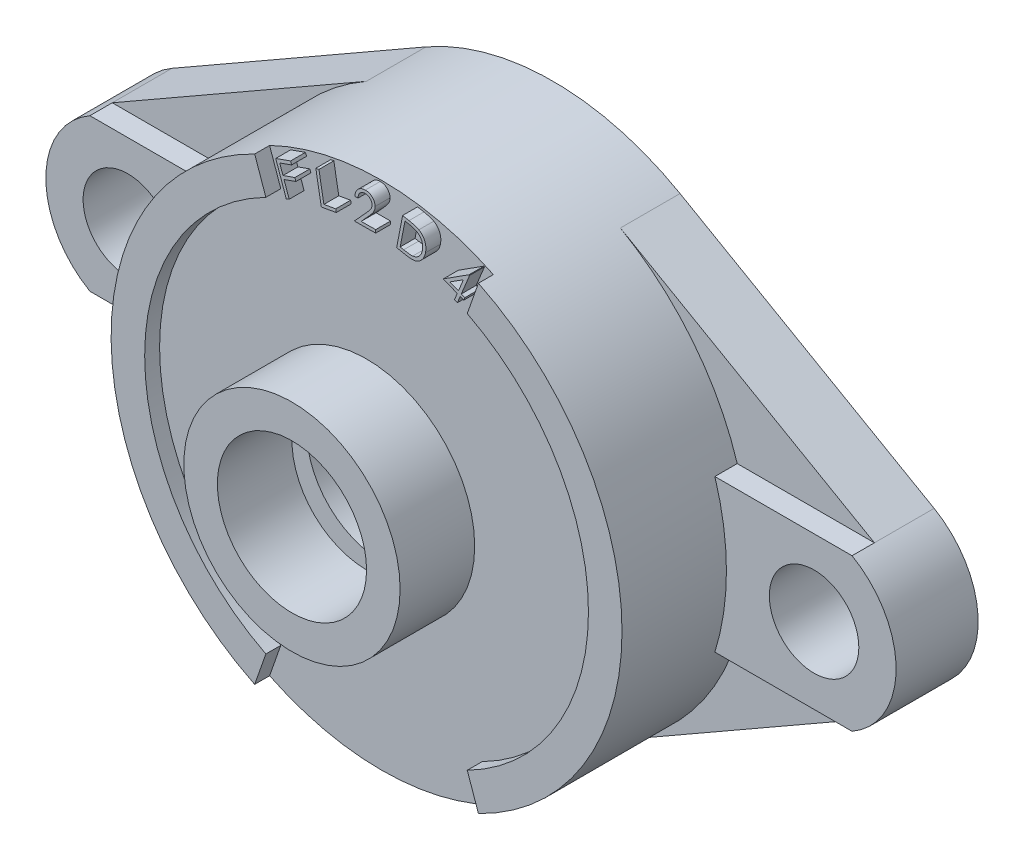
from build123d import *

# Parameters (mm, degrees)
RESSALTO_EXTRUS_O1_DEPTH = 8
ESBO_O2_R                = 34.25
RESSALTO_EXTRUS_O2_DEPTH = 17
RESSALTO_EXTRUS_O3_DEPTH = 3
ESBO_O4_R                = 6
CORTE_EXTRUS_O1_DEPTH    = 72.042680833
ESBO_O5_R                = 14.5
RESSALTO_EXTRUS_O4_DEPTH = 10
ESBO_O6_R                = 10
CORTE_EXTRUS_O2_DEPTH    = 76.146939392
ESBO_O7_OUTSIDE_W        = 143.506
ESBO_O7_OUTSIDE_H        = 98.006
CORTE_EXTRUS_O3_DEPTH    = 2
ENVOLVER1_DEPTH          = 2


# Read off the part's stored shape, not the designer's step: Envolver1
with BuildPart() as part:
    # Esboço1 → Ressalto-extrusão1 (new body)
    with BuildSketch(Plane.XY):
        with BuildLine():
            Line((-51.092541436, 10.194469558), (-17.03038674, 29.715794243))
            ThreePointArc((-17.03038674, 29.715794243), (0, 34.25), (17.03038674, 29.715794243))
            Line((17.03038674, 29.715794243), (51.092541436, 10.194469558))
            ThreePointArc((51.092541436, 10.194469558), (57, 0), (51.092541436, -10.194469558))
            Line((51.092541436, -10.194469558), (17.03038674, -29.715794243))
            ThreePointArc((17.03038674, -29.715794243), (0, -34.25), (-17.03038674, -29.715794243))
            Line((-17.03038674, -29.715794243), (-51.092541436, -10.194469558))
            ThreePointArc((-51.092541436, -10.194469558), (-57, 0), (-51.092541436, 10.194469558))
        make_face()
    extrude(amount=RESSALTO_EXTRUS_O1_DEPTH)

    # Esboço2 → Ressalto-extrusão2 (add)
    with BuildSketch(Plane.XY.offset(8)):
        with Locations(Location((0, 0, 0), (0, 0, 240.182593289))):
            Circle(ESBO_O2_R)
    extrude(amount=RESSALTO_EXTRUS_O2_DEPTH)

    # Esboço3 → Ressalto-extrusão3 (add)
    with BuildSketch(Plane.XY.offset(8)):
        with BuildLine():
            Line((-51.092541436, 10.194469558), (-32.697634325, 10.194469558))
            ThreePointArc((-32.697634325, 10.194469558), (-34.25, 0), (-32.697634325, -10.194469558))
            Line((-32.697634325, -10.194469558), (-51.092541436, -10.194469558))
            ThreePointArc((-51.092541436, -10.194469558), (-57, 0), (-51.092541436, 10.194469558))
        make_face()
        with BuildLine():
            Line((51.092541436, -10.194469558), (32.697634325, -10.194469558))
            ThreePointArc((32.697634325, -10.194469558), (34.25, 0), (32.697634325, 10.194469558))
            Line((32.697634325, 10.194469558), (51.092541436, 10.194469558))
            ThreePointArc((51.092541436, 10.194469558), (57, 0), (51.092541436, -10.194469558))
        make_face()
    extrude(amount=RESSALTO_EXTRUS_O3_DEPTH)

    # Esboço4 → Corte-extrusão1 (cut, through all)
    with BuildSketch(Plane.XY.offset(25)):
        with Locations((46, 0)):
            Circle(ESBO_O4_R)
        with Locations((-46, 0)):
            Circle(ESBO_O4_R)
    extrude(amount=-CORTE_EXTRUS_O1_DEPTH, mode=Mode.SUBTRACT)

    # Esboço5 → Ressalto-extrusão4 (add)
    with BuildSketch(Plane.XY.offset(25)):
        Circle(ESBO_O5_R)
    extrude(amount=RESSALTO_EXTRUS_O4_DEPTH)

    # Esboço6 → Corte-extrusão2 (cut, through all)
    with BuildSketch(Plane.XY.offset(35)):
        Circle(ESBO_O6_R)
    extrude(amount=-CORTE_EXTRUS_O2_DEPTH, mode=Mode.SUBTRACT)

    # Esboço7 outside → Corte-extrusão3 (cut)
    with BuildSketch(Plane.XY.offset(25)):
        Rectangle(ESBO_O7_OUTSIDE_W, ESBO_O7_OUTSIDE_H)
        with BuildLine():
            Line((-15, 30.790623573), (-13.5, 26.510611083))
            ThreePointArc((-13.5, 26.510611083), (-29.75, 0), (-13.5, -26.510611083))
            Line((-13.5, -26.510611083), (-15, -30.790623573))
            ThreePointArc((-15, -30.790623573), (-34.25, 0), (-15, 30.790623573))
        make_face(mode=Mode.SUBTRACT)
        with BuildLine():
            Line((15, 30.790623573), (13.5, 26.510611083))
            ThreePointArc((13.5, 26.510611083), (29.75, 0), (13.5, -26.510611083))
            Line((13.5, -26.510611083), (15, -30.790623573))
            ThreePointArc((15, -30.790623573), (34.25, 0), (15, 30.790623573))
        make_face(mode=Mode.SUBTRACT)
    extrude(amount=-CORTE_EXTRUS_O3_DEPTH, mode=Mode.SUBTRACT)


with BuildPart() as corte_extrus_o3_piece_1:
    # of the separate pieces the step leaves, piece 1, a body of its own (corte_extrus_o3_pieces)
    add(part.part.solids().sort_by_distance((-17.03038674, -29.715794243, 0))[0])

    # Envolver1 outline → Envolver1 (add)
    # profile 1 of 5: a face of its own
    with BuildSketch(Plane.XY.offset(23)):
        with BuildLine():
            add(Edge.make_bspline(
                [(5.693276198, 33.40841641), (5.767695719, 33.393510808), (5.911505929, 33.364706839), (6.118219204, 33.317244355), (6.30837934, 33.268451391), (6.481311816, 33.217356236), (6.638044338, 33.166589069), (6.777093101, 33.111656221), (6.900861767, 33.057947634), (6.975198959, 33.016616807), (7.0102567, 32.99712501)],
                knots=[0, 0, 0, 0, 0.164364974, 0.317623132, 0.459276207, 0.589452798, 0.708124693, 0.815898103, 0.913176748, 1, 1, 1, 1], degree=3))
            Line((5.693276198, 33.40841641), (4.836772459, 33.574629016))
            Line((4.836772459, 33.574629016), (4.0336942, 29.44221048))
            Line((4.0336942, 29.44221048), (5.348130632, 29.186955405))
            add(Edge.make_bspline(
                [(7.904921497, 30.779543546), (7.89425594, 30.72878763), (7.873190648, 30.628540809), (7.830850543, 30.482712074), (7.783340554, 30.342287275), (7.726015526, 30.209222308), (7.662158007, 30.08198929), (7.591174764, 29.960757748), (7.512219404, 29.845860342), (7.42542269, 29.738688606), (7.334612339, 29.638090959), (7.23921346, 29.545887356), (7.139935665, 29.463084805), (7.037807619, 29.387682398), (6.931852475, 29.321467351), (6.821957454, 29.264528847), (6.708848162, 29.216148207), (6.591508882, 29.175334314), (6.467368051, 29.145191221), (6.335113045, 29.122572499), (6.193245889, 29.111676746), (6.04208748, 29.108472568), (5.881502967, 29.113268447), (5.711831519, 29.129557034), (5.532620567, 29.152767441), (5.410790209, 29.175343913), (5.348130632, 29.186955405)],
                knots=[0, 0, 0, 0, 0.045317656, 0.089505841, 0.132637655, 0.17481341, 0.216028701, 0.257005575, 0.297509689, 0.337756009, 0.377461736, 0.415904309, 0.453613369, 0.490380608, 0.526784926, 0.562700494, 0.598452514, 0.634238669, 0.671152559, 0.709984603, 0.751391264, 0.795382141, 0.842103291, 0.891718496, 0.944308846, 1, 1, 1, 1], degree=3))
            add(Edge.make_bspline(
                [(7.0102567, 32.99712501), (7.055727328, 32.969355482), (7.145663012, 32.914430543), (7.270213361, 32.819146205), (7.386057012, 32.71789479), (7.491187028, 32.607362884), (7.586216626, 32.488941318), (7.67018722, 32.361588714), (7.74541942, 32.227250015), (7.809437468, 32.084979391), (7.862878286, 31.936739234), (7.904609101, 31.783601011), (7.933910728, 31.626154155), (7.953209677, 31.464685051), (7.95825293, 31.298820502), (7.953698606, 31.129084961), (7.93541829, 30.955182847), (7.915210532, 30.838800891), (7.904921497, 30.779543546)],
                knots=[0, 0, 0, 0, 0.06235802, 0.123337006, 0.183379652, 0.242385747, 0.30173814, 0.36095929, 0.420830118, 0.481871974, 0.54344474, 0.605201447, 0.667531341, 0.730850315, 0.795445854, 0.86168483, 0.929575081, 1, 1, 1, 1], degree=3))
        make_face()
        with BuildLine():
            add(Edge.make_bspline(
                [(4.982632501, 29.662696591), (5.05128362, 29.649764017), (5.183323032, 29.624890286), (5.373810136, 29.592509367), (5.548802594, 29.566798387), (5.707716455, 29.547938371), (5.851136565, 29.5358832), (5.978682192, 29.52960858), (6.090915622, 29.529321742), (6.159997824, 29.535863053), (6.191914018, 29.53888516)],
                knots=[0, 0, 0, 0, 0.17187218, 0.33056856, 0.475346307, 0.606986553, 0.724230232, 0.829358741, 0.921163204, 1, 1, 1, 1], degree=3))
            Line((4.982632501, 29.662696591), (4.505195268, 29.755131153))
            Line((4.505195268, 29.755131153), (5.154781273, 33.095495736))
            Line((5.154781273, 33.095495736), (5.447349382, 33.038678162))
            add(Edge.make_bspline(
                [(6.702424168, 32.672332008), (6.669562944, 32.688906306), (6.599331617, 32.724329059), (6.482708787, 32.770724848), (6.350307458, 32.817368722), (6.201309036, 32.862777577), (6.03623141, 32.908532041), (5.854617142, 32.953176967), (5.656727408, 32.997433844), (5.518931649, 33.024577533), (5.447349382, 33.038678162)],
                knots=[0, 0, 0, 0, 0.084164568, 0.179877333, 0.28684788, 0.405284564, 0.536135687, 0.678709153, 0.833095537, 1, 1, 1, 1], degree=3))
            add(Edge.make_bspline(
                [(7.485997886, 30.855017638), (7.494488898, 30.904114626), (7.511211208, 31.000806877), (7.526022831, 31.145277544), (7.528888185, 31.286126407), (7.523815425, 31.423409793), (7.506188485, 31.556532882), (7.48051615, 31.686401232), (7.442482648, 31.812009725), (7.396209936, 31.934101081), (7.340482001, 32.050771109), (7.275771365, 32.161052715), (7.201616754, 32.263806782), (7.11910922, 32.360026817), (7.027942625, 32.449283248), (6.928456995, 32.532019207), (6.819505238, 32.606873359), (6.741795083, 32.650320192), (6.702424168, 32.672332008)],
                knots=[0, 0, 0, 0, 0.070113513, 0.138082471, 0.204141949, 0.268253602, 0.331218166, 0.392933621, 0.454359888, 0.515684296, 0.57654107, 0.636105878, 0.695395036, 0.754641467, 0.814281955, 0.874744746, 0.936540931, 1, 1, 1, 1], degree=3))
            add(Edge.make_bspline(
                [(6.191914018, 29.53888516), (6.232467096, 29.544680584), (6.31281416, 29.556162951), (6.429834885, 29.585559761), (6.542372447, 29.622989256), (6.650485204, 29.668565634), (6.753295752, 29.724032164), (6.85122305, 29.788127681), (6.945020724, 29.860164408), (7.032757623, 29.941808361), (7.115398918, 30.030552558), (7.189897897, 30.127828275), (7.2578114, 30.231616109), (7.319531553, 30.341959835), (7.371555883, 30.460503341), (7.417313254, 30.585425238), (7.456996352, 30.717232015), (7.476205672, 30.808495055), (7.485997886, 30.855017638)],
                knots=[0, 0, 0, 0, 0.061913086, 0.122667256, 0.182144808, 0.241136506, 0.299850324, 0.35853924, 0.417963004, 0.478464006, 0.539569056, 0.601129931, 0.663492936, 0.727017147, 0.792077522, 0.859020483, 0.928133763, 1, 1, 1, 1], degree=3))
        make_face(mode=Mode.SUBTRACT)
    # profile 2 of 5: a face of its own
    with BuildSketch(Plane.XY.offset(23)):
        with BuildLine():
            add(Edge.make_bspline(
                [(-1.55782557, 32.587360452), (-1.555600019, 32.638313615), (-1.551229484, 32.738375358), (-1.529725152, 32.884569003), (-1.496434586, 33.023861147), (-1.45208619, 33.156671716), (-1.393228706, 33.281809187), (-1.325122624, 33.401411492), (-1.242692123, 33.512789289), (-1.149846834, 33.616699742), (-1.048050652, 33.710787769), (-0.939785542, 33.794187859), (-0.824942095, 33.863653417), (-0.704211665, 33.921082861), (-0.577768243, 33.966015375), (-0.445112815, 33.998421328), (-0.306718473, 34.018028587), (-0.212357178, 34.021370262), (-0.164522953, 34.023064245)],
                knots=[0, 0, 0, 0, 0.068621733, 0.134759254, 0.198535008, 0.261228818, 0.322860456, 0.384407459, 0.446208022, 0.50899876, 0.571738744, 0.632548488, 0.692652894, 0.752055774, 0.812233612, 0.872961151, 0.935600662, 1, 1, 1, 1], degree=3))
            Line((-1.55782557, 32.587360452), (-1.154166382, 32.590752546))
            add(Edge.make_bspline(
                [(-0.184875517, 33.621949128), (-0.217719268, 33.620897535), (-0.282553413, 33.618821672), (-0.377259554, 33.604647619), (-0.468214484, 33.584120491), (-0.554132618, 33.552657079), (-0.636707827, 33.515085636), (-0.714410785, 33.467786695), (-0.787661747, 33.412340695), (-0.856272912, 33.348845048), (-0.918798975, 33.277826184), (-0.974625601, 33.199766784), (-1.022789177, 33.114610894), (-1.064337477, 33.022993419), (-1.098638682, 32.92455183), (-1.124148189, 32.819360405), (-1.144428403, 32.70755223), (-1.150860118, 32.630408679), (-1.154166382, 32.590752546)],
                knots=[0, 0, 0, 0, 0.062528699, 0.123432755, 0.182060323, 0.239781276, 0.297343865, 0.35458335, 0.412614741, 0.4720401, 0.532303194, 0.592503741, 0.65446679, 0.718309468, 0.783854318, 0.852660488, 0.924259189, 1, 1, 1, 1], degree=3))
            add(Edge.make_bspline(
                [(0.733533938, 32.760357247), (0.732397101, 32.789519277), (0.730156974, 32.846982762), (0.717131378, 32.93167845), (0.696289002, 33.013130806), (0.665869117, 33.090979475), (0.628469929, 33.166127009), (0.582812523, 33.238337556), (0.527565793, 33.306522241), (0.465663444, 33.371197399), (0.397339122, 33.430000749), (0.325296078, 33.482208609), (0.2492017, 33.525556297), (0.169775742, 33.56151806), (0.086341601, 33.589753431), (-0.000964233, 33.608969018), (-0.091856226, 33.620267843), (-0.153465847, 33.621381411), (-0.184875517, 33.621949128)],
                knots=[0, 0, 0, 0, 0.062475209, 0.123106769, 0.183176336, 0.242214629, 0.301790797, 0.362769093, 0.424805523, 0.489472496, 0.554298036, 0.617650368, 0.679763587, 0.741554245, 0.804170152, 0.86807569, 0.932742663, 1, 1, 1, 1], degree=3))
            add(Edge.make_bspline(
                [(-0.040711521, 31.445072792), (-0.001851003, 31.48735214), (0.072784684, 31.568554047), (0.178250112, 31.687569621), (0.272797635, 31.798246818), (0.357207767, 31.899957687), (0.430250072, 31.993430795), (0.493138822, 32.078179761), (0.546106268, 32.154148242), (0.601347163, 32.243888634), (0.65516245, 32.352731567), (0.701666336, 32.48554107), (0.728812521, 32.622149318), (0.731955905, 32.714164173), (0.733533938, 32.760357247)],
                knots=[0, 0, 0, 0, 0.110101451, 0.211461344, 0.304871876, 0.389185495, 0.464860738, 0.532284105, 0.591516046, 0.642360909, 0.734224057, 0.823694639, 0.911491611, 1, 1, 1, 1], degree=3))
            Line((-0.040711521, 31.445072792), (-1.63753978, 29.695600303))
            Line((-1.63753978, 29.695600303), (1.221995477, 29.715952867))
            Line((1.221995477, 29.715952867), (1.219451406, 30.122156125))
            Line((1.219451406, 30.122156125), (-0.724218466, 30.108587749))
            Line((-0.724218466, 30.108587749), (0.314610327, 31.246635292))
            add(Edge.make_bspline(
                [(1.143129291, 32.772229576), (1.141645174, 32.713285317), (1.138704826, 32.596504299), (1.105677692, 32.424424305), (1.052926663, 32.257822647), (0.990621847, 32.122734325), (0.927403642, 32.013861174), (0.869309027, 31.9251703), (0.802399706, 31.828782583), (0.723653551, 31.726788949), (0.636447752, 31.61595121), (0.538260719, 31.498896333), (0.430113541, 31.374631993), (0.354038725, 31.290328491), (0.314610327, 31.246635292)],
                knots=[0, 0, 0, 0, 0.099141813, 0.196420857, 0.293815115, 0.392848323, 0.446160006, 0.505702957, 0.571329286, 0.643679537, 0.722624506, 0.808797595, 0.900902757, 1, 1, 1, 1], degree=3))
            add(Edge.make_bspline(
                [(-0.164522953, 34.023064245), (-0.117256345, 34.02228577), (-0.024662023, 34.020760753), (0.110634519, 34.002964146), (0.239657726, 33.975844641), (0.361237563, 33.934373161), (0.47689152, 33.882925478), (0.58461456, 33.817969726), (0.685706201, 33.741701519), (0.778750723, 33.654927037), (0.863386411, 33.560403134), (0.936991187, 33.460151457), (1.000669224, 33.356456005), (1.051565611, 33.247542962), (1.092568959, 33.135031388), (1.121641695, 33.017662071), (1.138479069, 32.896241259), (1.141569236, 32.813832983), (1.143129291, 32.772229576)],
                knots=[0, 0, 0, 0, 0.070148506, 0.137419494, 0.202302343, 0.265622381, 0.32780937, 0.389938241, 0.451981966, 0.515547817, 0.578576368, 0.640118191, 0.700015971, 0.758978265, 0.818333745, 0.877588199, 0.938201014, 1, 1, 1, 1], degree=3))
        make_face()
    # profile 3 of 5: a face of its own
    with BuildSketch(Plane.XY.offset(23)):
        Polygon((12.703968473, 28.392918804), (13.818271357, 31.109986112), (13.738557148, 31.143059028), (10.298125791, 28.943286058), (12.160385406, 28.180064904), (11.788951112, 27.273527778), (12.179041924, 27.113251336), (12.550476218, 28.019788462), (13.021977287, 27.826439103), (13.175469541, 28.199569445), align=None)
        Polygon((11.166501859, 29.023000268), (12.980424135, 30.17800828), (12.313877661, 28.553195246), align=None, mode=Mode.SUBTRACT)
    # profile 4 of 5: a face of its own
    with BuildSketch(Plane.XY.offset(23)):
        Polygon((-5.721381667, 29.578037987), (-6.386232095, 33.311885476), (-6.801763612, 33.238107431), (-6.06567921, 29.105688895), (-4.062647693, 29.46270679), (-4.133881667, 29.861277837), align=None)
    # profile 5 of 5: a face of its own
    with BuildSketch(Plane.XY.offset(23)):
        Polygon((-10.047095318, 32.000764431), (-10.186171173, 32.39255129), (-12.178178384, 31.686995734), (-10.769611344, 27.710613523), (-10.375280414, 27.850537401), (-11.065571547, 29.799295414), (-9.467895265, 30.364927091), (-9.606971119, 30.75671395), (-11.204647401, 30.191082273), (-11.6447716, 31.435132753), align=None)
    extrude(amount=ENVOLVER1_DEPTH)


with BuildPart() as corte_extrus_o3_piece_2:
    # of the separate pieces the step leaves, piece 2, a body of its own (corte_extrus_o3_pieces)
    add(part.part.solids().sort_by_distance((10, 0, 35))[0])


solid = Compound([corte_extrus_o3_piece_1.part, corte_extrus_o3_piece_2.part])
